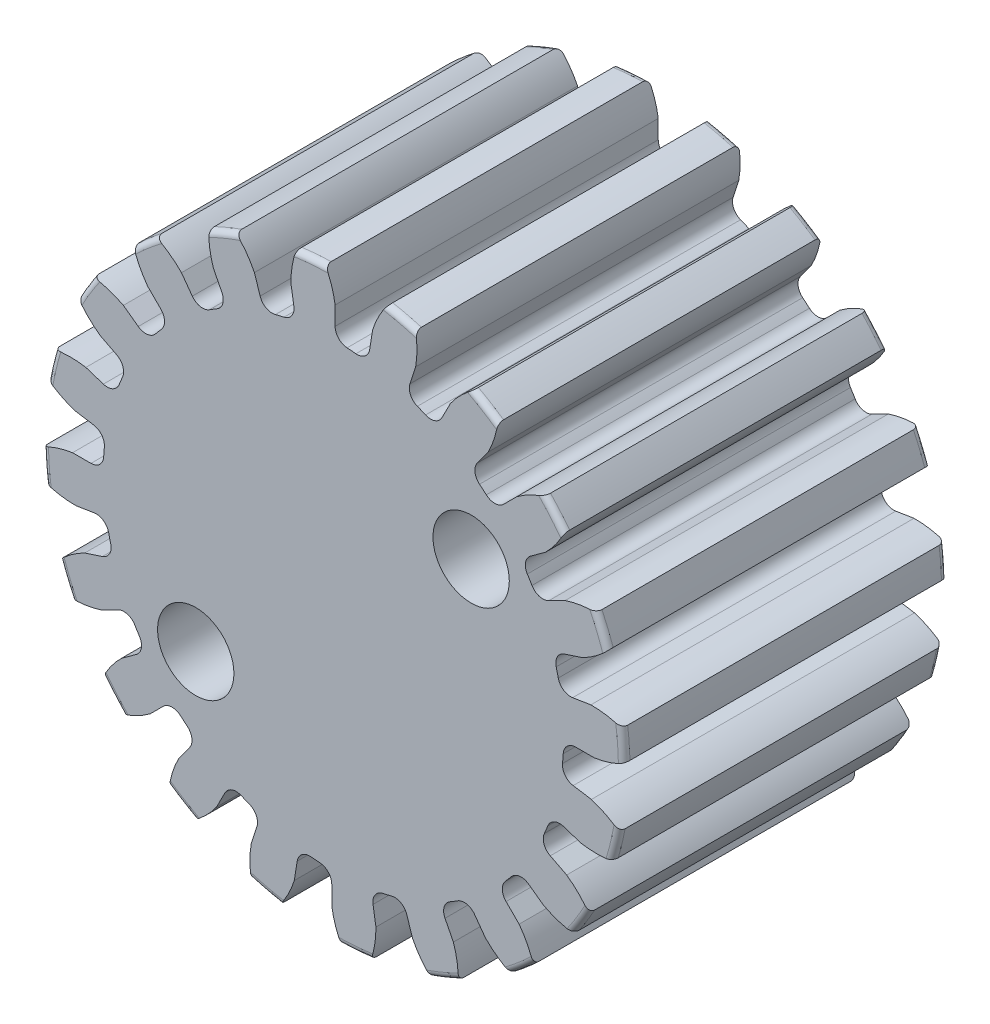
from build123d import *

# Parameters (mm, degrees)
SKETCH1_R           = 5.715
BOSS_EXTRUDE1_DEPTH = 6.35
SKETCH2_W           = 6.35
SKETCH2_H           = 4.7625
FILLET2_R           = 0.1143
CUT_EXTRUDE1_DEPTH  = 6.35
FILLET1_R           = 0.249563992
CIRPATTERN1_START   = -6.35
CIRPATTERN1_DEPTH   = 6.35
SKETCH5_R           = 2
CUT_EXTRUDE2_DEPTH  = 13.489891652
CHAMFER1_SIZE       = 0.238125
CUT_EXTRUDE3_START  = -3.175
SKETCH6_R           = 4.7625
CUT_EXTRUDE3_DEPTH  = 3.175
SKETCH7_R           = 2.238125
BOSS_EXTRUDE2_DEPTH = 6.35
SKETCH8_R           = 0.75
CUT_EXTRUDE4_DEPTH  = 11.275907246


# Read off the part's stored shape, not the designer's step: CirPattern1
with BuildPart() as part:
    # Sketch1 → Boss-Extrude1 (new body)
    with BuildSketch(Plane.XY):
        Circle(SKETCH1_R)
    extrude(amount=-BOSS_EXTRUDE1_DEPTH)

    # Sketch2 → Revolve1 (revolve)
    with BuildSketch(Plane(origin=(0, 0, 0), x_dir=(0, 0, -1), z_dir=(1, 0, 0)), mode=Mode.PRIVATE) as revolve1_sk:
        with Locations((6.35, 2.38125)):
            Rectangle(SKETCH2_W, SKETCH2_H)
    revolve(revolve1_sk.sketch.rotate(Axis((0, 0, -3.175), (0, 0, -1)), 90), axis=Axis((0, 0, -3.175), (0, 0, -1)))

    # Fillet2
    fillet2_edges = [part.edges().sort_by_distance(p)[0] for p in [
        (-5.715, 0, 0),
        (-5.715, 0, -6.35),
    ]]
    fillet(fillet2_edges, radius=FILLET2_R)

    # Sketch4 → Cut-Extrude1 (cut)
    with BuildSketch(Plane.XY):
        with BuildLine():
            Line((0.033105528, 5.127106209), (0.033105528, 4.523301354))
            ThreePointArc((0.033105528, 4.523301354), (0.354904467, 4.509478233), (0.674903926, 4.472790606))
            Line((0.674903926, 4.472790606), (0.769360035, 5.069161587))
            add(Edge.make_bspline(
                [(1.504694003, 6.05479747), (0.955155709, 5.660253512), (0.769360035, 5.069161587)],
                knots=[0, 0, 0, 1, 1, 1], degree=2))
            ThreePointArc((1.504694003, 6.05479747), (0.489504645, 6.219731638), (-0.538987437, 6.215639065))
            add(Edge.make_bspline(
                [(-0.538987437, 6.215639065), (-0.057935318, 5.739985693), (0.033105528, 5.127106209)],
                knots=[0, 0, 0, 1, 1, 1], degree=2))
        make_face()
    extrude(amount=-CUT_EXTRUDE1_DEPTH, mode=Mode.SUBTRACT)

    # Fillet1
    # the kernel refuses this fillet: 0.249563992 mm, written as the material it adds along each edge
    with BuildSketch(Plane(origin=(0.674903926, 4.472790606, 0), x_dir=(-0.9923475631458823, 0.12347596494228733, 0), z_dir=(0, 0, -1))) as fillet1_piece_1:
        with BuildLine():
            CenterArc((0.241394546, 0.249479842), FILLET1_R * 0.999999998397, 181.907267855, 86.6047981)
            Line((-0.008031187, 0.241173865), (0, 0))
            ThreePointArc((0, 0), (0.11745713, 0.001525228), (0.234914261, 0))
        make_face()
    extrude(amount=6.35)
    with BuildSketch(Plane(origin=(0.033105528, 4.523301354, 0), x_dir=(0, 1, 0), z_dir=(0, 0, -1))) as fillet1_piece_2:
        with BuildLine():
            CenterArc((0.241307548, 0.249563992), FILLET1_R * 0.999999998397, 183.3952019, 86.6047981)
            ThreePointArc((-0.007818406, 0.234784119), (-0.00238482, 0.117442822), (0, 0))
            Line((0, 0), (0.241307548, 0))
        make_face()
    extrude(amount=6.35)

    # CirPattern1 outline → CirPattern1 (cut)
    with BuildSketch(Plane.XY.offset(CIRPATTERN1_START)):
        with BuildLine():
            Line((-0.778045262, 4.7007701), (-0.834752203, 5.058804485))
            add(Edge.make_bspline(
                [(-0.834752203, 5.058804485), (-0.837768738, 5.372639768), (-0.736442204, 5.667353642)],
                knots=[0, 0, 0, 0.506532467, 0.506532467, 0.506532467], degree=2))
            ThreePointArc((-0.736442204, 5.667353642), (-1.334139234, 5.557094341), (-1.916747356, 5.383985939))
            add(Edge.make_bspline(
                [(-1.916747356, 5.383985939), (-1.692668104, 5.167396755), (-1.552877722, 4.886397941)],
                knots=[0.493467533, 0.493467533, 0.493467533, 1, 1, 1], degree=2))
            Line((-1.552877722, 4.886397941), (-1.440859894, 4.541642515))
            ThreePointArc((-1.440859894, 4.541642515), (-1.32334776, 4.399852914), (-1.140582774, 4.377261935))
            ThreePointArc((-1.140582774, 4.377261935), (-1.055971203, 4.39844017), (-0.970967017, 4.417983043))
            ThreePointArc((-0.970967017, 4.417983043), (-0.818378274, 4.521085263), (-0.778045262, 4.7007701))
        make_face()
        with BuildLine():
            add(Edge.make_bspline(
                [(2.298161952, 4.583313834), (2.480189275, 4.838984986), (2.735392631, 5.017855276)],
                knots=[0, 0, 0, 0.506532467, 0.506532467, 0.506532467], degree=2))
            ThreePointArc((2.735392631, 5.017855276), (2.187036785, 5.279971125), (1.613946348, 5.482371948))
            add(Edge.make_bspline(
                [(1.613946348, 5.482371948), (1.667922343, 5.17543714), (1.615848179, 4.865937599)],
                knots=[0.493467533, 0.493467533, 0.493467533, 1, 1, 1], degree=2))
            Line((1.615848179, 4.865937599), (1.503830351, 4.521182173))
            ThreePointArc((1.503830351, 4.521182173), (1.515557827, 4.337400077), (1.650139163, 4.211697028))
            ThreePointArc((1.650139163, 4.211697028), (1.731039616, 4.179097147), (1.811296459, 4.144943456))
            ThreePointArc((1.811296459, 4.144943456), (1.995345311, 4.138665491), (2.1335915, 4.260326429))
            Line((2.1335915, 4.260326429), (2.298161952, 4.583313834))
        make_face()
        with BuildLine():
            add(Edge.make_bspline(
                [(3.602003765, 3.648819389), (3.854128768, 3.835727568), (4.152115542, 3.926981149)],
                knots=[0, 0, 0, 0.506532467, 0.506532467, 0.506532467], degree=2))
            ThreePointArc((4.152115542, 3.926981149), (3.711596393, 4.34571941), (3.229100292, 4.715308716))
            add(Edge.make_bspline(
                [(3.229100292, 4.715308716), (3.185586443, 4.406716867), (3.040420352, 4.128457114)],
                knots=[0.493467533, 0.493467533, 0.493467533, 1, 1, 1], degree=2))
            Line((3.040420352, 4.128457114), (2.827349781, 3.835190632))
            ThreePointArc((2.827349781, 3.835190632), (2.781711483, 3.656779483), (2.870861561, 3.495640859))
            ThreePointArc((2.870861561, 3.495640859), (2.937728546, 3.439636914), (3.003503269, 3.382354095))
            ThreePointArc((3.003503269, 3.382354095), (3.176604131, 3.319509174), (3.345679367, 3.392495179))
            Line((3.345679367, 3.392495179), (3.602003765, 3.648819389))
        make_face()
        with BuildLine():
            add(Edge.make_bspline(
                [(4.553256353, 2.357153079), (4.850799284, 2.45700241), (5.162400454, 2.451706746)],
                knots=[0, 0, 0, 0.506532467, 0.506532467, 0.506532467], degree=2))
            ThreePointArc((5.162400454, 2.451706746), (4.872839085, 2.986078401), (4.5281674, 3.486678213))
            add(Edge.make_bspline(
                [(4.5281674, 3.486678213), (4.391423146, 3.206636444), (4.167374997, 2.986854482)],
                knots=[0.493467533, 0.493467533, 0.493467533, 1, 1, 1], degree=2))
            Line((4.167374997, 2.986854482), (3.874108515, 2.773783911))
            ThreePointArc((3.874108515, 2.773783911), (3.775571837, 2.618207834), (3.810564026, 2.437407007))
            ThreePointArc((3.810564026, 2.437407007), (3.856852138, 2.363481056), (3.901706252, 2.28867635))
            ThreePointArc((3.901706252, 2.28867635), (4.046914806, 2.17541617), (4.230268827, 2.192582865))
            Line((4.230268827, 2.192582865), (4.553256353, 2.357153079))
        make_face()
        with BuildLine():
            add(Edge.make_bspline(
                [(5.058804485, 0.834752203), (5.372639768, 0.837768738), (5.667353642, 0.736442204)],
                knots=[0, 0, 0, 0.506532467, 0.506532467, 0.506532467], degree=2))
            ThreePointArc((5.667353642, 0.736442204), (5.557094337, 1.334139233), (5.383985934, 1.916747354))
            add(Edge.make_bspline(
                [(5.383985934, 1.916747354), (5.167396755, 1.692668104), (4.886397941, 1.552877722)],
                knots=[0.493467533, 0.493467533, 0.493467533, 1, 1, 1], degree=2))
            Line((4.886397941, 1.552877722), (4.541642515, 1.440859894))
            ThreePointArc((4.541642515, 1.440859894), (4.399852914, 1.32334776), (4.377261935, 1.140582774))
            ThreePointArc((4.377261935, 1.140582774), (4.39844017, 1.055971203), (4.417983043, 0.970967017))
            ThreePointArc((4.417983043, 0.970967017), (4.521085263, 0.818378274), (4.7007701, 0.778045262))
            Line((4.7007701, 0.778045262), (5.058804485, 0.834752203))
        make_face()
        with BuildLine():
            add(Edge.make_bspline(
                [(5.069161587, -0.769360035), (5.368568838, -0.863471576), (5.617546767, -1.050910431)],
                knots=[0, 0, 0, 0.506532467, 0.506532467, 0.506532467], degree=2))
            ThreePointArc((5.617546767, -1.050910431), (5.697382476, -0.448394778), (5.712782413, 0.15919191))
            add(Edge.make_bspline(
                [(5.712782413, 0.15919191), (5.437549566, 0.013009616), (5.127106209, -0.033105528)],
                knots=[0.493467533, 0.493467533, 0.493467533, 1, 1, 1], degree=2))
            Line((5.127106209, -0.033105528), (4.764608902, -0.033105528))
            ThreePointArc((4.764608902, -0.033105528), (4.593445732, -0.101050812), (4.515482948, -0.267889647))
            ThreePointArc((4.515482948, -0.267889647), (4.509478233, -0.354904467), (4.501796871, -0.441787332))
            ThreePointArc((4.501796871, -0.441787332), (4.552700395, -0.618768189), (4.711127244, -0.712652831))
            Line((4.711127244, -0.712652831), (5.069161587, -0.769360035))
        make_face()
        with BuildLine():
            add(Edge.make_bspline(
                [(4.583313834, -2.298161952), (4.838984986, -2.480189275), (5.017855276, -2.735392631)],
                knots=[0, 0, 0, 0.506532467, 0.506532467, 0.506532467], degree=2))
            ThreePointArc((5.017855276, -2.735392631), (5.279971123, -2.187036784), (5.482371945, -1.613946347))
            add(Edge.make_bspline(
                [(5.482371945, -1.613946347), (5.17543714, -1.667922343), (4.865937599, -1.615848179)],
                knots=[0.493467533, 0.493467533, 0.493467533, 1, 1, 1], degree=2))
            Line((4.865937599, -1.615848179), (4.521182173, -1.503830351))
            ThreePointArc((4.521182173, -1.503830351), (4.337400077, -1.515557827), (4.211697028, -1.650139163))
            ThreePointArc((4.211697028, -1.650139163), (4.179097147, -1.731039616), (4.144943456, -1.811296459))
            ThreePointArc((4.144943456, -1.811296459), (4.138665491, -1.995345311), (4.260326429, -2.1335915))
            Line((4.260326429, -2.1335915), (4.583313834, -2.298161952))
        make_face()
        with BuildLine():
            add(Edge.make_bspline(
                [(3.648819389, -3.602003765), (3.835727568, -3.854128768), (3.926981149, -4.152115542)],
                knots=[0, 0, 0, 0.506532467, 0.506532467, 0.506532467], degree=2))
            ThreePointArc((3.926981149, -4.152115542), (4.345719409, -3.711596392), (4.715308715, -3.229100291))
            add(Edge.make_bspline(
                [(4.715308715, -3.229100291), (4.406716867, -3.185586443), (4.128457114, -3.040420352)],
                knots=[0.493467533, 0.493467533, 0.493467533, 1, 1, 1], degree=2))
            Line((4.128457114, -3.040420352), (3.835190632, -2.827349781))
            ThreePointArc((3.835190632, -2.827349781), (3.656779483, -2.781711483), (3.495640859, -2.870861561))
            ThreePointArc((3.495640859, -2.870861561), (3.439636914, -2.937728546), (3.382354095, -3.003503269))
            ThreePointArc((3.382354095, -3.003503269), (3.319509174, -3.176604131), (3.392495179, -3.345679367))
            Line((3.392495179, -3.345679367), (3.648819389, -3.602003765))
        make_face()
        with BuildLine():
            add(Edge.make_bspline(
                [(2.357153079, -4.553256353), (2.45700241, -4.850799284), (2.451706746, -5.162400454)],
                knots=[0, 0, 0, 0.506532467, 0.506532467, 0.506532467], degree=2))
            ThreePointArc((2.451706746, -5.162400454), (2.986078401, -4.872839086), (3.486678213, -4.528167401))
            add(Edge.make_bspline(
                [(3.486678213, -4.528167401), (3.206636444, -4.391423146), (2.986854482, -4.167374997)],
                knots=[0.493467533, 0.493467533, 0.493467533, 1, 1, 1], degree=2))
            Line((2.986854482, -4.167374997), (2.773783911, -3.874108515))
            ThreePointArc((2.773783911, -3.874108515), (2.618207834, -3.775571837), (2.437407007, -3.810564026))
            ThreePointArc((2.437407007, -3.810564026), (2.363481056, -3.856852138), (2.28867635, -3.901706252))
            ThreePointArc((2.28867635, -3.901706252), (2.17541617, -4.046914806), (2.192582865, -4.230268827))
            Line((2.192582865, -4.230268827), (2.357153079, -4.553256353))
        make_face()
        with BuildLine():
            add(Edge.make_bspline(
                [(0.834752203, -5.058804485), (0.837768738, -5.372639768), (0.736442204, -5.667353642)],
                knots=[0, 0, 0, 0.506532467, 0.506532467, 0.506532467], degree=2))
            ThreePointArc((0.736442204, -5.667353642), (1.334139234, -5.557094339), (1.916747355, -5.383985936))
            add(Edge.make_bspline(
                [(1.916747355, -5.383985936), (1.692668104, -5.167396755), (1.552877722, -4.886397941)],
                knots=[0.493467533, 0.493467533, 0.493467533, 1, 1, 1], degree=2))
            Line((1.552877722, -4.886397941), (1.440859894, -4.541642515))
            ThreePointArc((1.440859894, -4.541642515), (1.32334776, -4.399852914), (1.140582774, -4.377261935))
            ThreePointArc((1.140582774, -4.377261935), (1.055971203, -4.39844017), (0.970967017, -4.417983043))
            ThreePointArc((0.970967017, -4.417983043), (0.818378274, -4.521085263), (0.778045262, -4.7007701))
            Line((0.778045262, -4.7007701), (0.834752203, -5.058804485))
        make_face()
        with BuildLine():
            add(Edge.make_bspline(
                [(-0.769360035, -5.069161587), (-0.863471576, -5.368568838), (-1.050910431, -5.617546767)],
                knots=[0, 0, 0, 0.506532467, 0.506532467, 0.506532467], degree=2))
            ThreePointArc((-1.050910431, -5.617546767), (-0.448394778, -5.69738248), (0.159191911, -5.712782416))
            add(Edge.make_bspline(
                [(0.159191911, -5.712782416), (0.013009616, -5.437549566), (-0.033105528, -5.127106209)],
                knots=[0.493467533, 0.493467533, 0.493467533, 1, 1, 1], degree=2))
            Line((-0.033105528, -5.127106209), (-0.033105528, -4.764608902))
            ThreePointArc((-0.033105528, -4.764608902), (-0.101050812, -4.593445732), (-0.267889647, -4.515482948))
            ThreePointArc((-0.267889647, -4.515482948), (-0.354904467, -4.509478233), (-0.441787332, -4.501796871))
            ThreePointArc((-0.441787332, -4.501796871), (-0.618768189, -4.552700395), (-0.712652831, -4.711127244))
            Line((-0.712652831, -4.711127244), (-0.769360035, -5.069161587))
        make_face()
        with BuildLine():
            add(Edge.make_bspline(
                [(-2.298161952, -4.583313834), (-2.480189275, -4.838984986), (-2.735392631, -5.017855276)],
                knots=[0, 0, 0, 0.506532467, 0.506532467, 0.506532467], degree=2))
            ThreePointArc((-2.735392631, -5.017855276), (-2.187036786, -5.279971128), (-1.613946348, -5.48237195))
            add(Edge.make_bspline(
                [(-1.613946348, -5.48237195), (-1.667922343, -5.17543714), (-1.615848179, -4.865937599)],
                knots=[0.493467533, 0.493467533, 0.493467533, 1, 1, 1], degree=2))
            Line((-1.615848179, -4.865937599), (-1.503830351, -4.521182173))
            ThreePointArc((-1.503830351, -4.521182173), (-1.515557827, -4.337400077), (-1.650139163, -4.211697028))
            ThreePointArc((-1.650139163, -4.211697028), (-1.731039616, -4.179097147), (-1.811296459, -4.144943456))
            ThreePointArc((-1.811296459, -4.144943456), (-1.995345311, -4.138665491), (-2.1335915, -4.260326429))
            Line((-2.1335915, -4.260326429), (-2.298161952, -4.583313834))
        make_face()
        with BuildLine():
            add(Edge.make_bspline(
                [(-3.602003765, -3.648819389), (-3.854128768, -3.835727568), (-4.152115542, -3.926981149)],
                knots=[0, 0, 0, 0.506532467, 0.506532467, 0.506532467], degree=2))
            ThreePointArc((-4.152115542, -3.926981149), (-3.711596396, -4.345719413), (-3.229100294, -4.715308719))
            add(Edge.make_bspline(
                [(-3.229100294, -4.715308719), (-3.185586443, -4.406716867), (-3.040420352, -4.128457114)],
                knots=[0.493467533, 0.493467533, 0.493467533, 1, 1, 1], degree=2))
            Line((-3.040420352, -4.128457114), (-2.827349781, -3.835190632))
            ThreePointArc((-2.827349781, -3.835190632), (-2.781711483, -3.656779483), (-2.870861561, -3.495640859))
            ThreePointArc((-2.870861561, -3.495640859), (-2.937728546, -3.439636914), (-3.003503269, -3.382354095))
            ThreePointArc((-3.003503269, -3.382354095), (-3.176604131, -3.319509174), (-3.345679367, -3.392495179))
            Line((-3.345679367, -3.392495179), (-3.602003765, -3.648819389))
        make_face()
        with BuildLine():
            add(Edge.make_bspline(
                [(-4.553256353, -2.357153079), (-4.850799284, -2.45700241), (-5.162400454, -2.451706746)],
                knots=[0, 0, 0, 0.506532467, 0.506532467, 0.506532467], degree=2))
            ThreePointArc((-5.162400454, -2.451706746), (-4.87283909, -2.986078404), (-4.528167405, -3.486678216))
            add(Edge.make_bspline(
                [(-4.528167405, -3.486678216), (-4.391423146, -3.206636444), (-4.167374997, -2.986854482)],
                knots=[0.493467533, 0.493467533, 0.493467533, 1, 1, 1], degree=2))
            Line((-4.167374997, -2.986854482), (-3.874108515, -2.773783911))
            ThreePointArc((-3.874108515, -2.773783911), (-3.775571837, -2.618207834), (-3.810564026, -2.437407007))
            ThreePointArc((-3.810564026, -2.437407007), (-3.856852138, -2.363481056), (-3.901706252, -2.28867635))
            ThreePointArc((-3.901706252, -2.28867635), (-4.046914806, -2.17541617), (-4.230268827, -2.192582865))
            Line((-4.230268827, -2.192582865), (-4.553256353, -2.357153079))
        make_face()
        with BuildLine():
            add(Edge.make_bspline(
                [(-5.058804485, -0.834752203), (-5.372639768, -0.837768738), (-5.667353642, -0.736442204)],
                knots=[0, 0, 0, 0.506532467, 0.506532467, 0.506532467], degree=2))
            ThreePointArc((-5.667353642, -0.736442204), (-5.557094343, -1.334139235), (-5.383985941, -1.916747357))
            add(Edge.make_bspline(
                [(-5.383985941, -1.916747357), (-5.167396755, -1.692668104), (-4.886397941, -1.552877722)],
                knots=[0.493467533, 0.493467533, 0.493467533, 1, 1, 1], degree=2))
            Line((-4.886397941, -1.552877722), (-4.541642515, -1.440859894))
            ThreePointArc((-4.541642515, -1.440859894), (-4.399852914, -1.32334776), (-4.377261935, -1.140582774))
            ThreePointArc((-4.377261935, -1.140582774), (-4.39844017, -1.055971203), (-4.417983043, -0.970967017))
            ThreePointArc((-4.417983043, -0.970967017), (-4.521085263, -0.818378274), (-4.7007701, -0.778045262))
            Line((-4.7007701, -0.778045262), (-5.058804485, -0.834752203))
        make_face()
        with BuildLine():
            add(Edge.make_bspline(
                [(-5.069161587, 0.769360035), (-5.368568838, 0.863471576), (-5.617546767, 1.050910431)],
                knots=[0, 0, 0, 0.506532467, 0.506532467, 0.506532467], degree=2))
            ThreePointArc((-5.617546767, 1.050910431), (-5.697382484, 0.448394779), (-5.71278242, -0.159191911))
            add(Edge.make_bspline(
                [(-5.71278242, -0.159191911), (-5.437549566, -0.013009616), (-5.127106209, 0.033105528)],
                knots=[0.493467533, 0.493467533, 0.493467533, 1, 1, 1], degree=2))
            Line((-5.127106209, 0.033105528), (-4.764608902, 0.033105528))
            ThreePointArc((-4.764608902, 0.033105528), (-4.593445732, 0.101050812), (-4.515482948, 0.267889647))
            ThreePointArc((-4.515482948, 0.267889647), (-4.509478233, 0.354904467), (-4.501796871, 0.441787332))
            ThreePointArc((-4.501796871, 0.441787332), (-4.552700395, 0.618768189), (-4.711127244, 0.712652831))
            Line((-4.711127244, 0.712652831), (-5.069161587, 0.769360035))
        make_face()
        with BuildLine():
            add(Edge.make_bspline(
                [(-4.583313834, 2.298161952), (-4.838984986, 2.480189275), (-5.017855276, 2.735392631)],
                knots=[0, 0, 0, 0.506532467, 0.506532467, 0.506532467], degree=2))
            ThreePointArc((-5.017855276, 2.735392631), (-5.27997113, 2.187036787), (-5.482371952, 1.613946349))
            add(Edge.make_bspline(
                [(-5.482371952, 1.613946349), (-5.17543714, 1.667922343), (-4.865937599, 1.615848179)],
                knots=[0.493467533, 0.493467533, 0.493467533, 1, 1, 1], degree=2))
            Line((-4.865937599, 1.615848179), (-4.521182173, 1.503830351))
            ThreePointArc((-4.521182173, 1.503830351), (-4.337400077, 1.515557827), (-4.211697028, 1.650139163))
            ThreePointArc((-4.211697028, 1.650139163), (-4.179097147, 1.731039616), (-4.144943456, 1.811296459))
            ThreePointArc((-4.144943456, 1.811296459), (-4.138665491, 1.995345311), (-4.260326429, 2.1335915))
            Line((-4.260326429, 2.1335915), (-4.583313834, 2.298161952))
        make_face()
        with BuildLine():
            add(Edge.make_bspline(
                [(-3.648819389, 3.602003765), (-3.835727568, 3.854128768), (-3.926981149, 4.152115542)],
                knots=[0, 0, 0, 0.506532467, 0.506532467, 0.506532467], degree=2))
            ThreePointArc((-3.926981149, 4.152115542), (-4.345719414, 3.711596396), (-4.71530872, 3.229100295))
            add(Edge.make_bspline(
                [(-4.71530872, 3.229100295), (-4.406716867, 3.185586443), (-4.128457114, 3.040420352)],
                knots=[0.493467533, 0.493467533, 0.493467533, 1, 1, 1], degree=2))
            Line((-4.128457114, 3.040420352), (-3.835190632, 2.827349781))
            ThreePointArc((-3.835190632, 2.827349781), (-3.656779483, 2.781711483), (-3.495640859, 2.870861561))
            ThreePointArc((-3.495640859, 2.870861561), (-3.439636914, 2.937728546), (-3.382354095, 3.003503269))
            ThreePointArc((-3.382354095, 3.003503269), (-3.319509174, 3.176604131), (-3.392495179, 3.345679367))
            Line((-3.392495179, 3.345679367), (-3.648819389, 3.602003765))
        make_face()
        with BuildLine():
            add(Edge.make_bspline(
                [(-2.357153079, 4.553256353), (-2.45700241, 4.850799284), (-2.451706746, 5.162400454)],
                knots=[0, 0, 0, 0.506532467, 0.506532467, 0.506532467], degree=2))
            ThreePointArc((-2.451706746, 5.162400454), (-2.986078403, 4.872839089), (-3.486678216, 4.528167404))
            add(Edge.make_bspline(
                [(-3.486678216, 4.528167404), (-3.206636444, 4.391423146), (-2.986854482, 4.167374997)],
                knots=[0.493467533, 0.493467533, 0.493467533, 1, 1, 1], degree=2))
            Line((-2.986854482, 4.167374997), (-2.773783911, 3.874108515))
            ThreePointArc((-2.773783911, 3.874108515), (-2.618207834, 3.775571837), (-2.437407007, 3.810564026))
            ThreePointArc((-2.437407007, 3.810564026), (-2.363481056, 3.856852138), (-2.28867635, 3.901706252))
            ThreePointArc((-2.28867635, 3.901706252), (-2.17541617, 4.046914806), (-2.192582865, 4.230268827))
            Line((-2.192582865, 4.230268827), (-2.357153079, 4.553256353))
        make_face()
    extrude(amount=CIRPATTERN1_DEPTH, mode=Mode.SUBTRACT)

    # Sketch5 → Cut-Extrude2 (cut, through all)
    with BuildSketch(Plane.XY):
        Circle(SKETCH5_R)
    extrude(amount=-CUT_EXTRUDE2_DEPTH, mode=Mode.SUBTRACT)

    # Chamfer1
    chamfer1_edges = [part.edges().sort_by_distance(p)[0] for p in [
        (-4.7625, 0, -9.525),
        (-2, 0, -9.525),
        (-2, 0, 0),
    ]]
    chamfer(chamfer1_edges, length=CHAMFER1_SIZE)

    # Sketch6 → Cut-Extrude3 (cut)
    with BuildSketch(Plane(origin=(0, 0, -9.525), x_dir=(-1, 0, 0), z_dir=(0, 0, -1)).offset(CUT_EXTRUDE3_START)):
        Circle(SKETCH6_R)
    extrude(amount=CUT_EXTRUDE3_DEPTH, mode=Mode.SUBTRACT)

    # Sketch7 → Boss-Extrude2 (add)
    with BuildSketch(Plane.XY):
        Circle(SKETCH7_R)
    extrude(amount=-BOSS_EXTRUDE2_DEPTH)

    # Sketch8 → Cut-Extrude4 (cut, through all)
    with BuildSketch(Plane.XY):
        with Locations((-2.705841104, -2.140309305)):
            Circle(SKETCH8_R)
        with Locations((2.705841104, 2.140309305)):
            Circle(SKETCH8_R)
    extrude(amount=-CUT_EXTRUDE4_DEPTH, mode=Mode.SUBTRACT)


solid = part.part
